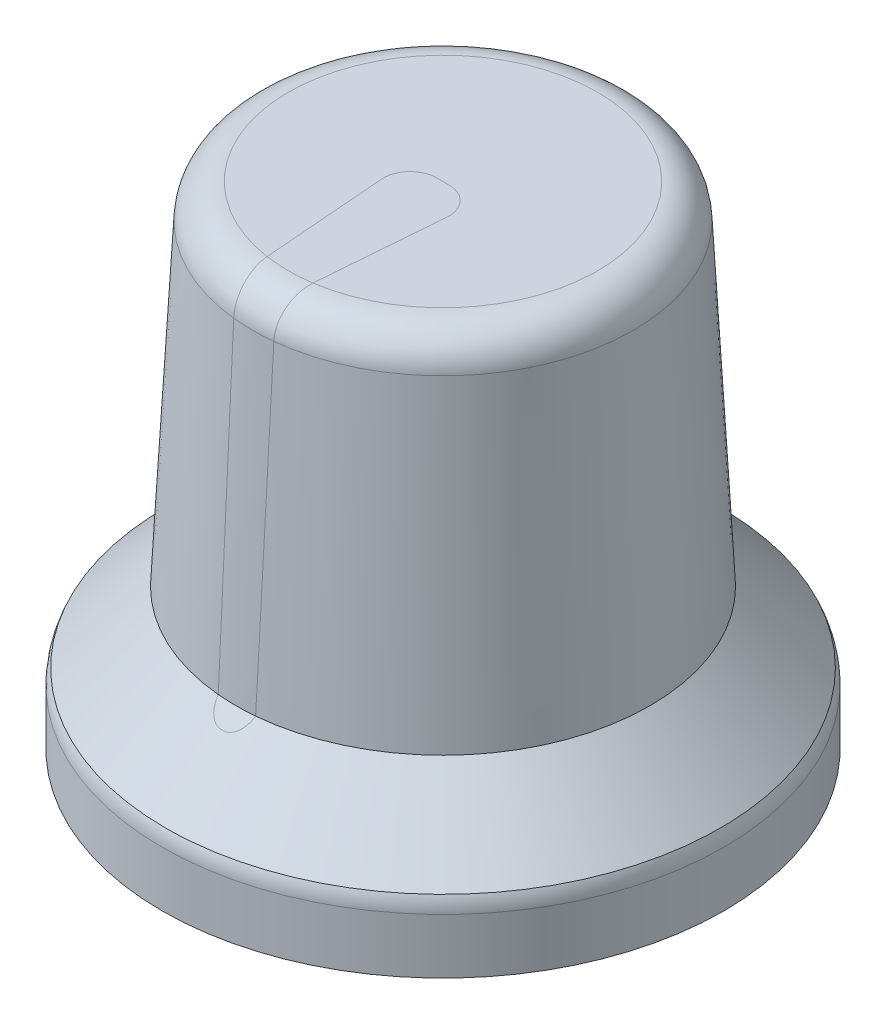
from build123d import *

# Parameters (mm, degrees)
SKETCH1_R           = 8
BOSS_EXTRUDE1_DEPTH = 2
SKETCH2_R           = 6
BOSS_EXTRUDE2_DEPTH = 12
BOSS_EXTRUDE2_TAPER = 3
FILLET1_R           = 1.016
CHAMFER1_SIZE       = 1.905
CHAMFER1_SIZE2      = 2.013117328
FILLET3_R           = 1.016


with BuildPart() as part:
    # Sketch1 → Boss-Extrude1 (new body)
    with BuildSketch(Plane(origin=(0, 0, 0), x_dir=(1, 0, 0), z_dir=(0, 1, 0))):
        with Locations(Location((0, 0, 0), (0, 0, 270))):
            Circle(SKETCH1_R)
    extrude(amount=BOSS_EXTRUDE1_DEPTH)

    # Sketch2 → Boss-Extrude2 (add)
    with BuildSketch(Plane(origin=(0, 2, 0), x_dir=(1, 0, 0), z_dir=(0, 1, 0))):
        Circle(SKETCH2_R)
    extrude(amount=BOSS_EXTRUDE2_DEPTH, taper=BOSS_EXTRUDE2_TAPER)

    # Fillet1
    fillet1_edges = [part.edges().sort_by_distance(p)[0] for p in [
        (-5.371106649, 14, 0),
    ]]
    fillet(fillet1_edges, radius=FILLET1_R)

    # Chamfer1
    chamfer1_edges = [part.edges().sort_by_distance(p)[0] for p in [
        (-6, 2, 0),
    ]]
    chamfer1_side = [part.faces().sort_by_distance(p)[0] for p in [
        (0, 2, -7.77372583),
    ]]
    chamfer(chamfer1_edges, length=CHAMFER1_SIZE, length2=CHAMFER1_SIZE2, reference=chamfer1_side[0])

    # Fillet3
    # the kernel refuses this fillet: 1.016 mm, written as the material it takes off along each edge
    with BuildSketch(Plane(origin=(0, 2, 0), x_dir=(0, 0, 1), z_dir=(-1, 0, 0))) as fillet3_piece_1:
        with BuildLine():
            CenterArc((6.984, -0.428969696), FILLET3_R, 0, 24.97446259)
            Line((8, -0.428969696), (8.02032, -0.428969696))
            Line((8.02032, -0.428969696), (8.02032, 0))
            Line((8.02032, 0), (8, 0.02032))
            ThreePointArc((8, 0.02032), (7.9525, 0.02032), (7.92342, 0.008579394))
            Line((7.92342, 0.008579394), (7.905, 0))
        make_face()
    revolve(axis=Axis((0, 2, 0), (0, 1, 0)), mode=Mode.SUBTRACT)


solid = part.part
